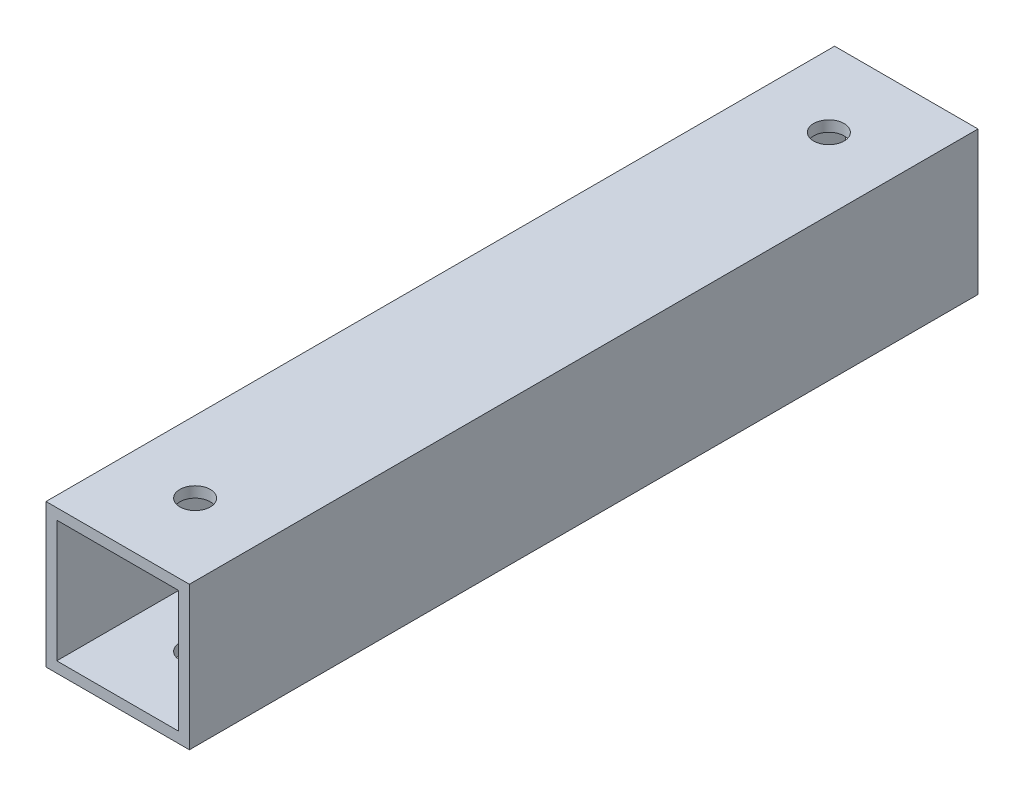
from build123d import *

# Parameters (mm, degrees)
SKETCH1_W           = 20
SKETCH1_H           = 20
SKETCH1_W_2         = 17
SKETCH1_H_2         = 17
BOSS_EXTRUDE1_DEPTH = 110
SKETCH2_R           = 2.125
CUT_EXTRUDE1_DEPTH  = 113.249721603


with BuildPart() as part:
    # Sketch1 → Boss-Extrude1 (new body)
    with BuildSketch(Plane.XY):
        Rectangle(SKETCH1_W, SKETCH1_H)
        Rectangle(SKETCH1_W_2, SKETCH1_H_2, mode=Mode.SUBTRACT)
    extrude(amount=-BOSS_EXTRUDE1_DEPTH)

    # Sketch2 → Cut-Extrude1 (cut, through all)
    with BuildSketch(Plane(origin=(0, 10, 0), x_dir=(1, 0, 0), z_dir=(0, 1, 0))):
        with Locations((0, 10.8)):
            Circle(SKETCH2_R)
        with Locations((0, 99.2)):
            Circle(SKETCH2_R)
    extrude(amount=-CUT_EXTRUDE1_DEPTH, mode=Mode.SUBTRACT)


solid = part.part
